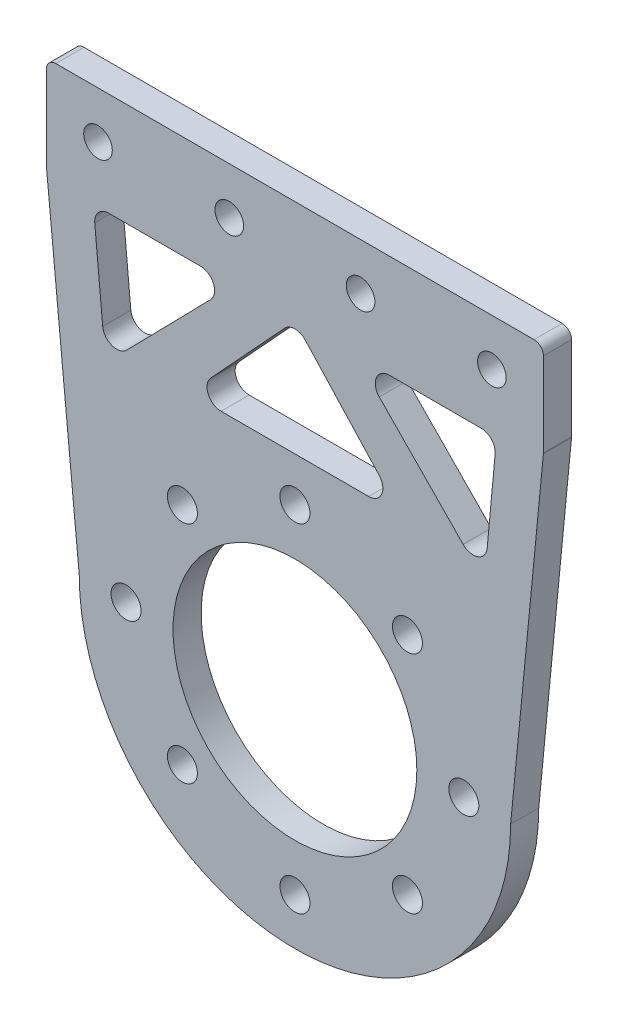
from build123d import *

# Parameters (mm, degrees)
EXTRUDE_2_DEPTH          = 3
FILLET_3_R               = 1
SKETCH_3_R               = 13
SKETCH_3_R_2             = 1.6
CUT_EXTRUDE_5_DEPTH      = 3
CUT_EXTRUDE_6_DEPTH      = 54.17189107
CUT_EXTRUDE_6_DEPTH_BACK = 54.17189107
SKETCH_4_R               = 1.525
CUT_EXTRUDE_7_DEPTH      = 10
FILLET_4_R               = 1.5


with BuildPart() as part:
    # 草圖2 → 填料-伸長2 (new body)
    with BuildSketch(Plane.XY):
        with BuildLine():
            Line((-26.5, 46), (26.5, 46))
            Line((26.5, 46), (26.5, 36))
            Line((26.5, 36), (23, 0))
            ThreePointArc((23, 0), (0, -23), (-23, 0))
            Line((-23, 0), (-26.5, 36))
            Line((-26.5, 36), (-26.5, 46))
        make_face()
    extrude(amount=EXTRUDE_2_DEPTH)

    # 圓角3
    # the kernel refuses this fillet: 1 mm, written as the material it takes off along each edge
    with BuildSketch(Plane(origin=(-26.5, 46, -2.5), x_dir=(0, -1, 0), z_dir=(0, 0, 1)), Plane(origin=(26.5, 46, -2.5), x_dir=(-1, 0, 0), z_dir=(0, 0, 1))) as fillet_3_piece_1:
        with BuildLine():
            CenterArc((FILLET_3_R, FILLET_3_R), FILLET_3_R, 180, 90)
            Line((0, FILLET_3_R), (0, 0))
            Line((0, 0), (FILLET_3_R, 0))
        make_face()
    extrude(amount=8, mode=Mode.SUBTRACT)
    with BuildSketch(Plane(origin=(26.5, 36, -0.121241952), x_dir=(0, 1, 0), z_dir=(0, 0, 1)), Plane(origin=(-26.5, 36, -0.121241952), x_dir=(0.0967659740606196, -0.9953071617667079, 0), z_dir=(0, 0, 1))) as fillet_3_piece_2:
        with BuildLine():
            CenterArc((FILLET_3_R * 0.0484967808039, FILLET_3_R), FILLET_3_R, 264.447028967, 5.552971033)
            Line((-FILLET_3_R * 0.0482691932568, FILLET_3_R * 0.0046928382333), (0, 0))
            Line((0, 0), (FILLET_3_R * 0.0484967808039, 0))
        make_face()
    extrude(amount=3.242483904, mode=Mode.SUBTRACT)

    # 草圖3 → 除料-伸長5 (cut)
    with BuildSketch(Plane.XY):
        Circle(SKETCH_3_R)
        with Locations((18.009998301, 0)):
            Circle(SKETCH_3_R_2)
        with Locations((0, -18.009998301)):
            Circle(SKETCH_3_R_2)
        with Locations((-18.009998301, 0)):
            Circle(SKETCH_3_R_2)
        with Locations((0, 18.009998301)):
            Circle(SKETCH_3_R_2)
        with Locations((11.999602077, 11.999602077)):
            Circle(SKETCH_3_R_2)
        with Locations((11.999602077, -11.999602077)):
            Circle(SKETCH_3_R_2)
        with Locations((-11.999602077, -11.999602077)):
            Circle(SKETCH_3_R_2)
        with Locations((-11.999602077, 11.999602077)):
            Circle(SKETCH_3_R_2)
    extrude(amount=CUT_EXTRUDE_5_DEPTH, mode=Mode.SUBTRACT)

    # 草圖4 → 除料-伸長6 (cut, two sides: drawn at the far end of the back side and taken through both)
    with BuildSketch(Plane.XY.offset(-CUT_EXTRUDE_6_DEPTH_BACK)):
        with Locations((21, 41)):
            Circle(SKETCH_4_R)
        with Locations((7, 41)):
            Circle(SKETCH_4_R)
        with Locations((-7, 41)):
            Circle(SKETCH_4_R)
        with Locations((-21, 41)):
            Circle(SKETCH_4_R)
    extrude(amount=CUT_EXTRUDE_6_DEPTH + CUT_EXTRUDE_6_DEPTH_BACK, mode=Mode.SUBTRACT)

    # 草圖5 → 除料-伸長7 (cut)
    with BuildSketch(Plane.XY.offset(3)):
        Polygon((-21.5, 35), (-6.5, 35), (-20.2, 21), align=None)
        Polygon((11.3, 22.7), (-11.3, 22.7), (0, 34.95), align=None)
        Polygon((6.5, 35), (20.2, 21), (21.5, 35), align=None)
    extrude(amount=-CUT_EXTRUDE_7_DEPTH, mode=Mode.SUBTRACT)

    # 圓角4
    fillet_4_edges = [part.edges().sort_by_distance(p)[0] for p in [
        (6.5, 35, 1.5),
        (21.5, 35, 1.5),
        (20.2, 21, 1.5),
        (-11.3, 22.7, 1.5),
        (0, 34.95, 1.5),
        (11.3, 22.7, 1.5),
        (-20.2, 21, 1.5),
        (-21.5, 35, 1.5),
        (-6.5, 35, 1.5),
    ]]
    fillet(fillet_4_edges, radius=FILLET_4_R)


solid = part.part
